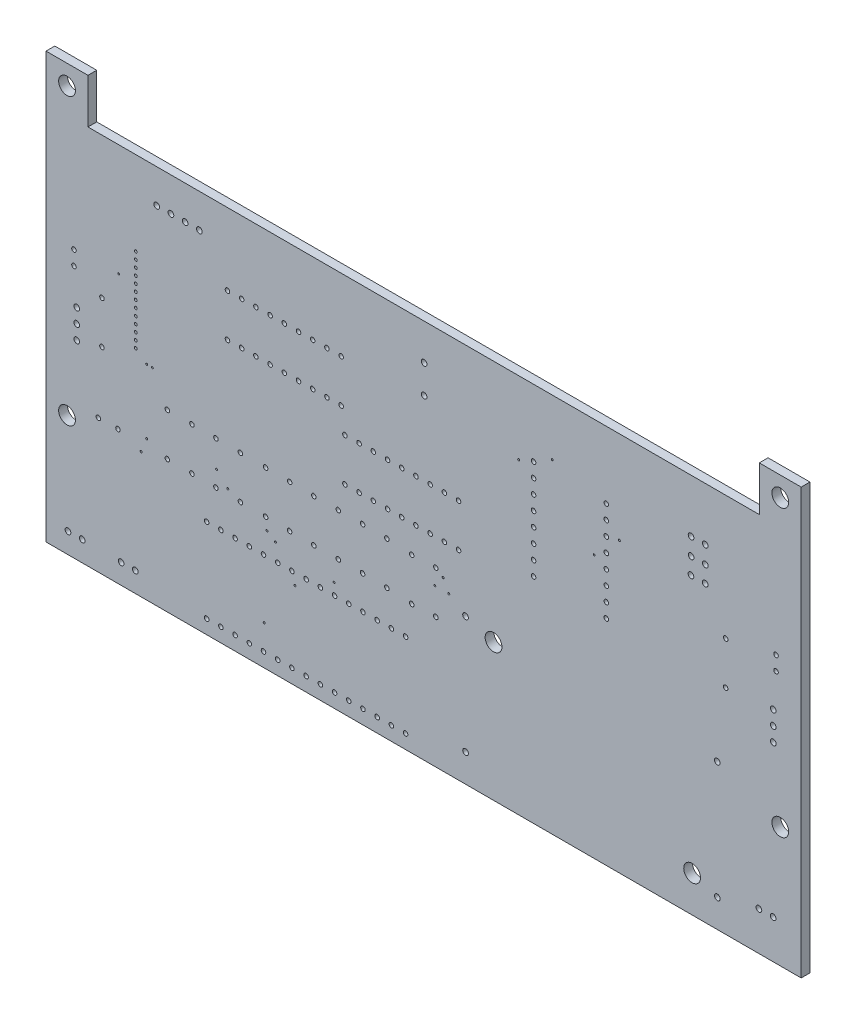
from build123d import *

# Parameters (mm, degrees)
ESQUISSE1_W             = 135
ESQUISSE1_H             = 76
ESQUISSE1_R             = 1.5
ESQUISSE1_R_2           = 0.508
ESQUISSE1_R_3           = 0.4065
ESQUISSE1_R_4           = 0.25
ESQUISSE1_R_5           = 0.175
ESQUISSE1_R_6           = 0.4
BOSS_EXTRU_1_DEPTH      = 1.57
ESQUISSE2_W             = 120
ESQUISSE2_H             = 8
ENL_V_MAT_EXTRU_1_DEPTH = 155.930516361


with BuildPart() as part:
    # Esquisse1 → Boss.-Extru.1 (new body)
    with BuildSketch(Plane.XY.offset(1.57)):
        with Locations((67.5, 38)):
            Rectangle(ESQUISSE1_W, ESQUISSE1_H)
        with Locations((115.5, 6.5)):
            Circle(ESQUISSE1_R, mode=Mode.SUBTRACT)
        with Locations((80, 24.5)):
            Circle(ESQUISSE1_R, mode=Mode.SUBTRACT)
        with Locations((3.76, 72.5)):
            Circle(ESQUISSE1_R, mode=Mode.SUBTRACT)
        with Locations((3.76, 21.5)):
            Circle(ESQUISSE1_R, mode=Mode.SUBTRACT)
        with Locations((131.26, 21.5)):
            Circle(ESQUISSE1_R, mode=Mode.SUBTRACT)
        with Locations((131.26, 72.5)):
            Circle(ESQUISSE1_R, mode=Mode.SUBTRACT)
        with Locations((120, 26)):
            Circle(ESQUISSE1_R_2, mode=Mode.SUBTRACT)
        with Locations((75, 26)):
            Circle(ESQUISSE1_R_2, mode=Mode.SUBTRACT)
        with Locations((130.5, 45.23)):
            Circle(ESQUISSE1_R_3, mode=Mode.SUBTRACT)
        with Locations((5, 45.23)):
            Circle(ESQUISSE1_R_3, mode=Mode.SUBTRACT)
        with Locations((16.05, 38)):
            Circle(ESQUISSE1_R_4, mode=Mode.SUBTRACT)
        with Locations((16.05, 40.5)):
            Circle(ESQUISSE1_R_4, mode=Mode.SUBTRACT)
        with Locations((16.05, 43)):
            Circle(ESQUISSE1_R_4, mode=Mode.SUBTRACT)
        with Locations((16.05, 45.5)):
            Circle(ESQUISSE1_R_4, mode=Mode.SUBTRACT)
        with Locations((16.05, 48)):
            Circle(ESQUISSE1_R_4, mode=Mode.SUBTRACT)
        with Locations((16.05, 50.5)):
            Circle(ESQUISSE1_R_4, mode=Mode.SUBTRACT)
        with Locations((16.05, 53)):
            Circle(ESQUISSE1_R_4, mode=Mode.SUBTRACT)
        with Locations((55.97, 43.26)):
            Circle(ESQUISSE1_R_3, mode=Mode.SUBTRACT)
        with Locations((61.05, 43.26)):
            Circle(ESQUISSE1_R_3, mode=Mode.SUBTRACT)
        with Locations((66.13, 43.26)):
            Circle(ESQUISSE1_R_3, mode=Mode.SUBTRACT)
        with Locations((71.21, 43.26)):
            Circle(ESQUISSE1_R_3, mode=Mode.SUBTRACT)
        with Locations((73.75, 35.64)):
            Circle(ESQUISSE1_R_3, mode=Mode.SUBTRACT)
        with Locations((68.67, 35.64)):
            Circle(ESQUISSE1_R_3, mode=Mode.SUBTRACT)
        with Locations((63.59, 35.64)):
            Circle(ESQUISSE1_R_3, mode=Mode.SUBTRACT)
        with Locations((58.51, 35.64)):
            Circle(ESQUISSE1_R_3, mode=Mode.SUBTRACT)
        with Locations((53.43, 35.64)):
            Circle(ESQUISSE1_R_3, mode=Mode.SUBTRACT)
        with Locations((34.98, 55.13)):
            Circle(ESQUISSE1_R_3, mode=Mode.SUBTRACT)
        with Locations((40.06, 55.13)):
            Circle(ESQUISSE1_R_3, mode=Mode.SUBTRACT)
        with Locations((45.14, 55.13)):
            Circle(ESQUISSE1_R_3, mode=Mode.SUBTRACT)
        with Locations((50.22, 55.13)):
            Circle(ESQUISSE1_R_3, mode=Mode.SUBTRACT)
        with Locations((52.76, 47.51)):
            Circle(ESQUISSE1_R_3, mode=Mode.SUBTRACT)
        with Locations((47.68, 47.51)):
            Circle(ESQUISSE1_R_3, mode=Mode.SUBTRACT)
        with Locations((42.6, 47.51)):
            Circle(ESQUISSE1_R_3, mode=Mode.SUBTRACT)
        with Locations((37.52, 47.51)):
            Circle(ESQUISSE1_R_3, mode=Mode.SUBTRACT)
        with Locations((32.44, 47.51)):
            Circle(ESQUISSE1_R_3, mode=Mode.SUBTRACT)
        with Locations((19.79, 61.96)):
            Circle(ESQUISSE1_R_2, mode=Mode.SUBTRACT)
        with Locations((24.87, 61.96)):
            Circle(ESQUISSE1_R_2, mode=Mode.SUBTRACT)
        with Locations((121.5, 45.81)):
            Circle(ESQUISSE1_R_3, mode=Mode.SUBTRACT)
        with Locations((10, 42.81)):
            Circle(ESQUISSE1_R_3, mode=Mode.SUBTRACT)
        with Locations((56.59, 23.44)):
            Circle(ESQUISSE1_R_3, mode=Mode.SUBTRACT)
        with Locations((52.25, 23.44)):
            Circle(ESQUISSE1_R_3, mode=Mode.SUBTRACT)
        with Locations((47.87, 23.42)):
            Circle(ESQUISSE1_R_3, mode=Mode.SUBTRACT)
        with Locations((43.55, 23.47)):
            Circle(ESQUISSE1_R_3, mode=Mode.SUBTRACT)
        with Locations((39.26, 23.54)):
            Circle(ESQUISSE1_R_3, mode=Mode.SUBTRACT)
        with Locations((34.75, 23.56)):
            Circle(ESQUISSE1_R_3, mode=Mode.SUBTRACT)
        with Locations((30.38, 23.62)):
            Circle(ESQUISSE1_R_3, mode=Mode.SUBTRACT)
        with Locations((26.09, 23.65)):
            Circle(ESQUISSE1_R_3, mode=Mode.SUBTRACT)
        with Locations((69.68, 23.25)):
            Circle(ESQUISSE1_R_3, mode=Mode.SUBTRACT)
        with Locations((65.37, 23.09)):
            Circle(ESQUISSE1_R_3, mode=Mode.SUBTRACT)
        with Locations((60.93, 23.37)):
            Circle(ESQUISSE1_R_3, mode=Mode.SUBTRACT)
        with Locations((39, 7)):
            Circle(ESQUISSE1_R_5, mode=Mode.SUBTRACT)
        with Locations((130, 39.07)):
            Circle(ESQUISSE1_R_2, mode=Mode.SUBTRACT)
        with Locations((130, 33.99)):
            Circle(ESQUISSE1_R_2, mode=Mode.SUBTRACT)
        with Locations((5.49, 36.51)):
            Circle(ESQUISSE1_R_2, mode=Mode.SUBTRACT)
        with Locations((12.86, 23.91)):
            Circle(ESQUISSE1_R_6, mode=Mode.SUBTRACT)
        with Locations((67.59, 61.54)):
            Circle(ESQUISSE1_R_2, mode=Mode.SUBTRACT)
        with Locations((28.72, 17.5)):
            Circle(ESQUISSE1_R_3, mode=Mode.SUBTRACT)
        with Locations((33.8, 17.5)):
            Circle(ESQUISSE1_R_3, mode=Mode.SUBTRACT)
        with Locations((38.88, 17.5)):
            Circle(ESQUISSE1_R_3, mode=Mode.SUBTRACT)
        with Locations((43.96, 17.5)):
            Circle(ESQUISSE1_R_3, mode=Mode.SUBTRACT)
        with Locations((49.04, 17.5)):
            Circle(ESQUISSE1_R_3, mode=Mode.SUBTRACT)
        with Locations((54.12, 17.5)):
            Circle(ESQUISSE1_R_3, mode=Mode.SUBTRACT)
        with Locations((59.2, 17.5)):
            Circle(ESQUISSE1_R_3, mode=Mode.SUBTRACT)
        with Locations((64.28, 17.5)):
            Circle(ESQUISSE1_R_3, mode=Mode.SUBTRACT)
        with Locations((61.74, 2.5)):
            Circle(ESQUISSE1_R_3, mode=Mode.SUBTRACT)
        with Locations((56.66, 2.5)):
            Circle(ESQUISSE1_R_3, mode=Mode.SUBTRACT)
        with Locations((51.58, 2.5)):
            Circle(ESQUISSE1_R_3, mode=Mode.SUBTRACT)
        with Locations((46.5, 2.5)):
            Circle(ESQUISSE1_R_3, mode=Mode.SUBTRACT)
        with Locations((41.42, 2.5)):
            Circle(ESQUISSE1_R_3, mode=Mode.SUBTRACT)
        with Locations((36.34, 2.5)):
            Circle(ESQUISSE1_R_3, mode=Mode.SUBTRACT)
        with Locations((31.26, 2.5)):
            Circle(ESQUISSE1_R_3, mode=Mode.SUBTRACT)
        with Locations((87.16, 38.24)):
            Circle(ESQUISSE1_R_3, mode=Mode.SUBTRACT)
        with Locations((87.16, 43.32)):
            Circle(ESQUISSE1_R_3, mode=Mode.SUBTRACT)
        with Locations((87.16, 48.4)):
            Circle(ESQUISSE1_R_3, mode=Mode.SUBTRACT)
        with Locations((87.16, 53.48)):
            Circle(ESQUISSE1_R_3, mode=Mode.SUBTRACT)
        with Locations((100.16, 56.02)):
            Circle(ESQUISSE1_R_3, mode=Mode.SUBTRACT)
        with Locations((100.16, 50.94)):
            Circle(ESQUISSE1_R_3, mode=Mode.SUBTRACT)
        with Locations((100.16, 45.86)):
            Circle(ESQUISSE1_R_3, mode=Mode.SUBTRACT)
        with Locations((100.16, 40.78)):
            Circle(ESQUISSE1_R_3, mode=Mode.SUBTRACT)
        with Locations((13.43, 3.57)):
            Circle(ESQUISSE1_R_2, mode=Mode.SUBTRACT)
        with Locations((3.93, 3.64)):
            Circle(ESQUISSE1_R_2, mode=Mode.SUBTRACT)
        with Locations((117.85, 58.52)):
            Circle(ESQUISSE1_R_2, mode=Mode.SUBTRACT)
        with Locations((117.86, 55.46)):
            Circle(ESQUISSE1_R_2, mode=Mode.SUBTRACT)
        with Locations((117.83, 52.49)):
            Circle(ESQUISSE1_R_2, mode=Mode.SUBTRACT)
        with Locations((129.98, 6.93)):
            Circle(ESQUISSE1_R_2, mode=Mode.SUBTRACT)
        with Locations((72, 28)):
            Circle(ESQUISSE1_R_5, mode=Mode.SUBTRACT)
        with Locations((19, 36.5)):
            Circle(ESQUISSE1_R_5, mode=Mode.SUBTRACT)
        with Locations((51.5, 19.5)):
            Circle(ESQUISSE1_R_5, mode=Mode.SUBTRACT)
        with Locations((39.5, 21.5)):
            Circle(ESQUISSE1_R_5, mode=Mode.SUBTRACT)
        with Locations((41, 20.5)):
            Circle(ESQUISSE1_R_5, mode=Mode.SUBTRACT)
        with Locations((30.5, 26.5)):
            Circle(ESQUISSE1_R_5, mode=Mode.SUBTRACT)
        with Locations((32.5, 24.5)):
            Circle(ESQUISSE1_R_5, mode=Mode.SUBTRACT)
        with Locations((44.5, 15.5)):
            Circle(ESQUISSE1_R_5, mode=Mode.SUBTRACT)
        with Locations((69.5, 28)):
            Circle(ESQUISSE1_R_5, mode=Mode.SUBTRACT)
        with Locations((102.5, 51.5)):
            Circle(ESQUISSE1_R_5, mode=Mode.SUBTRACT)
        with Locations((71, 30)):
            Circle(ESQUISSE1_R_5, mode=Mode.SUBTRACT)
        with Locations((98, 47)):
            Circle(ESQUISSE1_R_5, mode=Mode.SUBTRACT)
        with Locations((17, 22.5)):
            Circle(ESQUISSE1_R_5, mode=Mode.SUBTRACT)
        with Locations((18, 25)):
            Circle(ESQUISSE1_R_5, mode=Mode.SUBTRACT)
        with Locations((84.5, 55)):
            Circle(ESQUISSE1_R_5, mode=Mode.SUBTRACT)
        with Locations((90.5, 58)):
            Circle(ESQUISSE1_R_5, mode=Mode.SUBTRACT)
        with Locations((13, 48)):
            Circle(ESQUISSE1_R_5, mode=Mode.SUBTRACT)
        with Locations((18, 36.5)):
            Circle(ESQUISSE1_R_5, mode=Mode.SUBTRACT)
        with Locations((127.44, 6.93)):
            Circle(ESQUISSE1_R_2, mode=Mode.SUBTRACT)
        with Locations((115.29, 52.49)):
            Circle(ESQUISSE1_R_2, mode=Mode.SUBTRACT)
        with Locations((115.32, 55.46)):
            Circle(ESQUISSE1_R_2, mode=Mode.SUBTRACT)
        with Locations((115.31, 58.52)):
            Circle(ESQUISSE1_R_2, mode=Mode.SUBTRACT)
        with Locations((6.47, 3.64)):
            Circle(ESQUISSE1_R_2, mode=Mode.SUBTRACT)
        with Locations((15.97, 3.57)):
            Circle(ESQUISSE1_R_2, mode=Mode.SUBTRACT)
        with Locations((100.16, 38.24)):
            Circle(ESQUISSE1_R_3, mode=Mode.SUBTRACT)
        with Locations((100.16, 43.32)):
            Circle(ESQUISSE1_R_3, mode=Mode.SUBTRACT)
        with Locations((100.16, 48.4)):
            Circle(ESQUISSE1_R_3, mode=Mode.SUBTRACT)
        with Locations((100.16, 53.48)):
            Circle(ESQUISSE1_R_3, mode=Mode.SUBTRACT)
        with Locations((87.16, 56.02)):
            Circle(ESQUISSE1_R_3, mode=Mode.SUBTRACT)
        with Locations((87.16, 50.94)):
            Circle(ESQUISSE1_R_3, mode=Mode.SUBTRACT)
        with Locations((87.16, 45.86)):
            Circle(ESQUISSE1_R_3, mode=Mode.SUBTRACT)
        with Locations((87.16, 40.78)):
            Circle(ESQUISSE1_R_3, mode=Mode.SUBTRACT)
        with Locations((28.72, 2.5)):
            Circle(ESQUISSE1_R_3, mode=Mode.SUBTRACT)
        with Locations((33.8, 2.5)):
            Circle(ESQUISSE1_R_3, mode=Mode.SUBTRACT)
        with Locations((38.88, 2.5)):
            Circle(ESQUISSE1_R_3, mode=Mode.SUBTRACT)
        with Locations((43.96, 2.5)):
            Circle(ESQUISSE1_R_3, mode=Mode.SUBTRACT)
        with Locations((49.04, 2.5)):
            Circle(ESQUISSE1_R_3, mode=Mode.SUBTRACT)
        with Locations((54.12, 2.5)):
            Circle(ESQUISSE1_R_3, mode=Mode.SUBTRACT)
        with Locations((59.2, 2.5)):
            Circle(ESQUISSE1_R_3, mode=Mode.SUBTRACT)
        with Locations((64.28, 2.5)):
            Circle(ESQUISSE1_R_3, mode=Mode.SUBTRACT)
        with Locations((61.74, 17.5)):
            Circle(ESQUISSE1_R_3, mode=Mode.SUBTRACT)
        with Locations((56.66, 17.5)):
            Circle(ESQUISSE1_R_3, mode=Mode.SUBTRACT)
        with Locations((51.58, 17.5)):
            Circle(ESQUISSE1_R_3, mode=Mode.SUBTRACT)
        with Locations((46.5, 17.5)):
            Circle(ESQUISSE1_R_3, mode=Mode.SUBTRACT)
        with Locations((41.42, 17.5)):
            Circle(ESQUISSE1_R_3, mode=Mode.SUBTRACT)
        with Locations((36.34, 17.5)):
            Circle(ESQUISSE1_R_3, mode=Mode.SUBTRACT)
        with Locations((31.26, 17.5)):
            Circle(ESQUISSE1_R_3, mode=Mode.SUBTRACT)
        with Locations((67.59, 56.46)):
            Circle(ESQUISSE1_R_2, mode=Mode.SUBTRACT)
        with Locations((9.36, 23.91)):
            Circle(ESQUISSE1_R_6, mode=Mode.SUBTRACT)
        with Locations((5.49, 39.05)):
            Circle(ESQUISSE1_R_2, mode=Mode.SUBTRACT)
        with Locations((5.49, 33.97)):
            Circle(ESQUISSE1_R_2, mode=Mode.SUBTRACT)
        with Locations((130, 36.53)):
            Circle(ESQUISSE1_R_2, mode=Mode.SUBTRACT)
        with Locations((21.69, 23.68)):
            Circle(ESQUISSE1_R_3, mode=Mode.SUBTRACT)
        with Locations((21.69, 31.3)):
            Circle(ESQUISSE1_R_3, mode=Mode.SUBTRACT)
        with Locations((60.93, 30.99)):
            Circle(ESQUISSE1_R_3, mode=Mode.SUBTRACT)
        with Locations((65.37, 30.71)):
            Circle(ESQUISSE1_R_3, mode=Mode.SUBTRACT)
        with Locations((69.68, 30.87)):
            Circle(ESQUISSE1_R_3, mode=Mode.SUBTRACT)
        with Locations((26.09, 31.27)):
            Circle(ESQUISSE1_R_3, mode=Mode.SUBTRACT)
        with Locations((30.38, 31.24)):
            Circle(ESQUISSE1_R_3, mode=Mode.SUBTRACT)
        with Locations((34.75, 31.18)):
            Circle(ESQUISSE1_R_3, mode=Mode.SUBTRACT)
        with Locations((39.26, 31.16)):
            Circle(ESQUISSE1_R_3, mode=Mode.SUBTRACT)
        with Locations((43.55, 31.09)):
            Circle(ESQUISSE1_R_3, mode=Mode.SUBTRACT)
        with Locations((47.87, 31.04)):
            Circle(ESQUISSE1_R_3, mode=Mode.SUBTRACT)
        with Locations((52.25, 31.06)):
            Circle(ESQUISSE1_R_3, mode=Mode.SUBTRACT)
        with Locations((56.59, 31.06)):
            Circle(ESQUISSE1_R_3, mode=Mode.SUBTRACT)
        with Locations((10, 35.19)):
            Circle(ESQUISSE1_R_3, mode=Mode.SUBTRACT)
        with Locations((121.5, 38.19)):
            Circle(ESQUISSE1_R_3, mode=Mode.SUBTRACT)
        with Locations((22.33, 61.96)):
            Circle(ESQUISSE1_R_2, mode=Mode.SUBTRACT)
        with Locations((27.41, 61.96)):
            Circle(ESQUISSE1_R_2, mode=Mode.SUBTRACT)
        with Locations((34.98, 47.51)):
            Circle(ESQUISSE1_R_3, mode=Mode.SUBTRACT)
        with Locations((40.06, 47.51)):
            Circle(ESQUISSE1_R_3, mode=Mode.SUBTRACT)
        with Locations((45.14, 47.51)):
            Circle(ESQUISSE1_R_3, mode=Mode.SUBTRACT)
        with Locations((50.22, 47.51)):
            Circle(ESQUISSE1_R_3, mode=Mode.SUBTRACT)
        with Locations((52.76, 55.13)):
            Circle(ESQUISSE1_R_3, mode=Mode.SUBTRACT)
        with Locations((47.68, 55.13)):
            Circle(ESQUISSE1_R_3, mode=Mode.SUBTRACT)
        with Locations((42.6, 55.13)):
            Circle(ESQUISSE1_R_3, mode=Mode.SUBTRACT)
        with Locations((37.52, 55.13)):
            Circle(ESQUISSE1_R_3, mode=Mode.SUBTRACT)
        with Locations((32.44, 55.13)):
            Circle(ESQUISSE1_R_3, mode=Mode.SUBTRACT)
        with Locations((55.97, 35.64)):
            Circle(ESQUISSE1_R_3, mode=Mode.SUBTRACT)
        with Locations((61.05, 35.64)):
            Circle(ESQUISSE1_R_3, mode=Mode.SUBTRACT)
        with Locations((66.13, 35.64)):
            Circle(ESQUISSE1_R_3, mode=Mode.SUBTRACT)
        with Locations((71.21, 35.64)):
            Circle(ESQUISSE1_R_3, mode=Mode.SUBTRACT)
        with Locations((73.75, 43.26)):
            Circle(ESQUISSE1_R_3, mode=Mode.SUBTRACT)
        with Locations((68.67, 43.26)):
            Circle(ESQUISSE1_R_3, mode=Mode.SUBTRACT)
        with Locations((63.59, 43.26)):
            Circle(ESQUISSE1_R_3, mode=Mode.SUBTRACT)
        with Locations((58.51, 43.26)):
            Circle(ESQUISSE1_R_3, mode=Mode.SUBTRACT)
        with Locations((53.43, 43.26)):
            Circle(ESQUISSE1_R_3, mode=Mode.SUBTRACT)
        with Locations((16.05, 51.75)):
            Circle(ESQUISSE1_R_4, mode=Mode.SUBTRACT)
        with Locations((16.05, 49.25)):
            Circle(ESQUISSE1_R_4, mode=Mode.SUBTRACT)
        with Locations((16.05, 46.75)):
            Circle(ESQUISSE1_R_4, mode=Mode.SUBTRACT)
        with Locations((16.05, 44.25)):
            Circle(ESQUISSE1_R_4, mode=Mode.SUBTRACT)
        with Locations((16.05, 41.75)):
            Circle(ESQUISSE1_R_4, mode=Mode.SUBTRACT)
        with Locations((16.05, 39.25)):
            Circle(ESQUISSE1_R_4, mode=Mode.SUBTRACT)
        with Locations((5, 47.77)):
            Circle(ESQUISSE1_R_3, mode=Mode.SUBTRACT)
        with Locations((130.5, 47.77)):
            Circle(ESQUISSE1_R_3, mode=Mode.SUBTRACT)
        with Locations((75, 5)):
            Circle(ESQUISSE1_R_2, mode=Mode.SUBTRACT)
        with Locations((120, 5)):
            Circle(ESQUISSE1_R_2, mode=Mode.SUBTRACT)
    extrude(amount=-BOSS_EXTRU_1_DEPTH)

    # Esquisse2 → Enlèv. mat.-Extru.1 (cut, through all)
    with BuildSketch(Plane.XY.offset(1.57)):
        with Locations((67.5, 72)):
            Rectangle(ESQUISSE2_W, ESQUISSE2_H)
    extrude(amount=-ENL_V_MAT_EXTRU_1_DEPTH, mode=Mode.SUBTRACT)


solid = part.part
